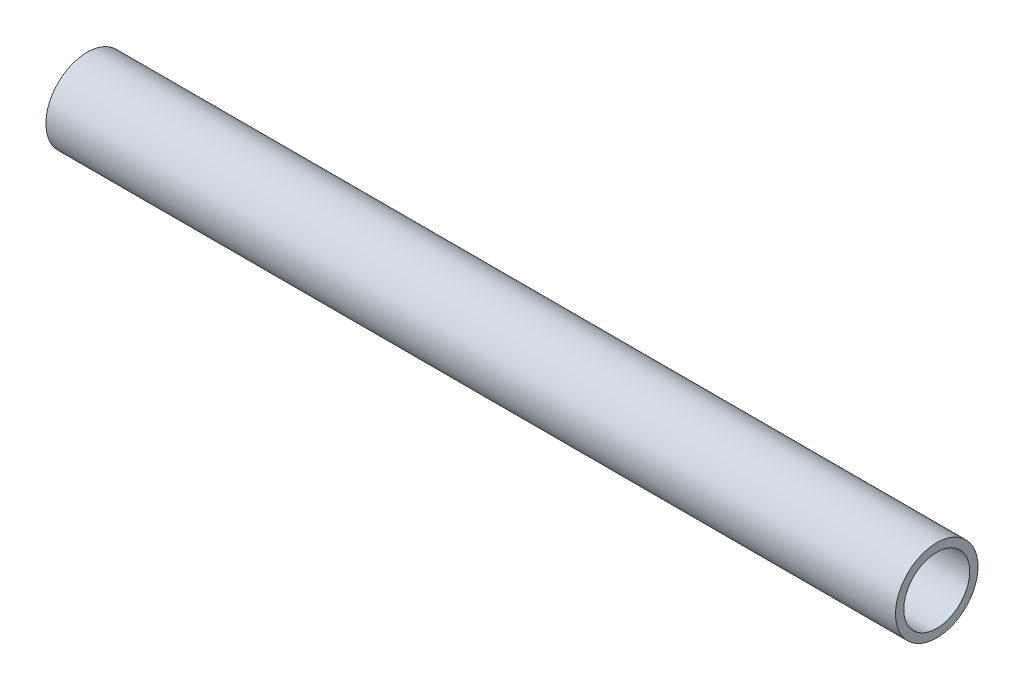
from build123d import *

# Parameters (mm, degrees)
SKETCH1_R           = 15.875
SKETCH1_R_2         = 12.7
EXTRUDE_THIN1_DEPTH = 163.496625


with BuildPart() as part:
    # Sketch1 → Extrude-Thin1 (new, symmetric)
    with BuildSketch(Plane(origin=(0, 0, 0), x_dir=(0, 0, -1), z_dir=(1, 0, 0))):
        Circle(SKETCH1_R)
        Circle(SKETCH1_R_2, mode=Mode.SUBTRACT)
    extrude(amount=EXTRUDE_THIN1_DEPTH, both=True)


solid = part.part
